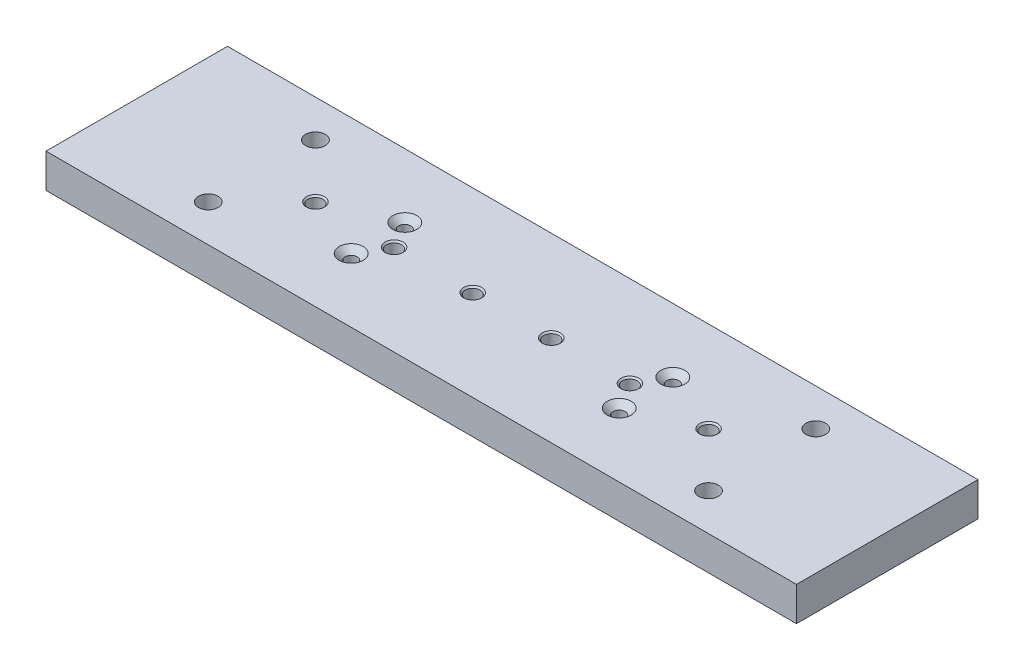
from build123d import *

# Parameters (mm, degrees)
SKETCH1_W                       = 210
SKETCH1_H                       = 50.8
BOSS_EXTRUDE1_DEPTH             = 9.525
CSK_FOR_M3_SFHCS1_D             = 3.4
CSK_FOR_M3_SFHCS1_CSINK_D       = 6.72
CSK_FOR_M3_SFHCS1_CSINK_ANGLE   = 90
M5_CLEARANCE_HOLE2_D            = 5.5
M5X0_8_TAPPED_HOLE1_D           = 4.2
M5X0_8_TAPPED_HOLE1_CSINK_D     = 5.05
M5X0_8_TAPPED_HOLE1_CSINK_ANGLE = 90


with BuildPart() as part:
    # Sketch1 → Boss-Extrude1 (new body)
    with BuildSketch(Plane(origin=(0, 0, 0), x_dir=(1, 0, 0), z_dir=(0, 1, 0))):
        Rectangle(SKETCH1_W, SKETCH1_H)
    extrude(amount=BOSS_EXTRUDE1_DEPTH)

    # CSK for M3 SFHCS1 (through all)
    with Locations(Plane(origin=(0, 9.525, 0), x_dir=(1, 0, 0), z_dir=(0, 1, 0))):
        with Locations((-37.5, 7.5), (-37.5, -7.5), (37.5, -7.5), (37.5, 7.5)):
            CounterSinkHole(CSK_FOR_M3_SFHCS1_D / 2, CSK_FOR_M3_SFHCS1_CSINK_D / 2, counter_sink_angle=CSK_FOR_M3_SFHCS1_CSINK_ANGLE)

    # M5 Clearance Hole2 (through all)
    with Locations(Plane(origin=(0, 9.525, 0), x_dir=(1, 0, 0), z_dir=(0, 1, 0))):
        with Locations((-70, -15), (-70, 15)):
            m5_clearance_hole2 = Hole(M5_CLEARANCE_HOLE2_D / 2)

    # Mirror1: M5 Clearance Hole2 across plane
    add(m5_clearance_hole2.mirror(Plane(origin=(0, 0, 0), x_dir=(0, 0, 1), z_dir=(1, 0, 0))), mode=Mode.SUBTRACT)

    # M5x0.8 Tapped Hole1 (through all)
    with Locations(Plane(origin=(0, 9.525, 0), x_dir=(1, 0, 0), z_dir=(0, 1, 0))):
        with Locations((-55, 0), (-33, 0), (-11, 0), (11, 0), (33, 0), (55, 0)):
            CounterSinkHole(M5X0_8_TAPPED_HOLE1_D / 2, M5X0_8_TAPPED_HOLE1_CSINK_D / 2, counter_sink_angle=M5X0_8_TAPPED_HOLE1_CSINK_ANGLE)


solid = part.part
